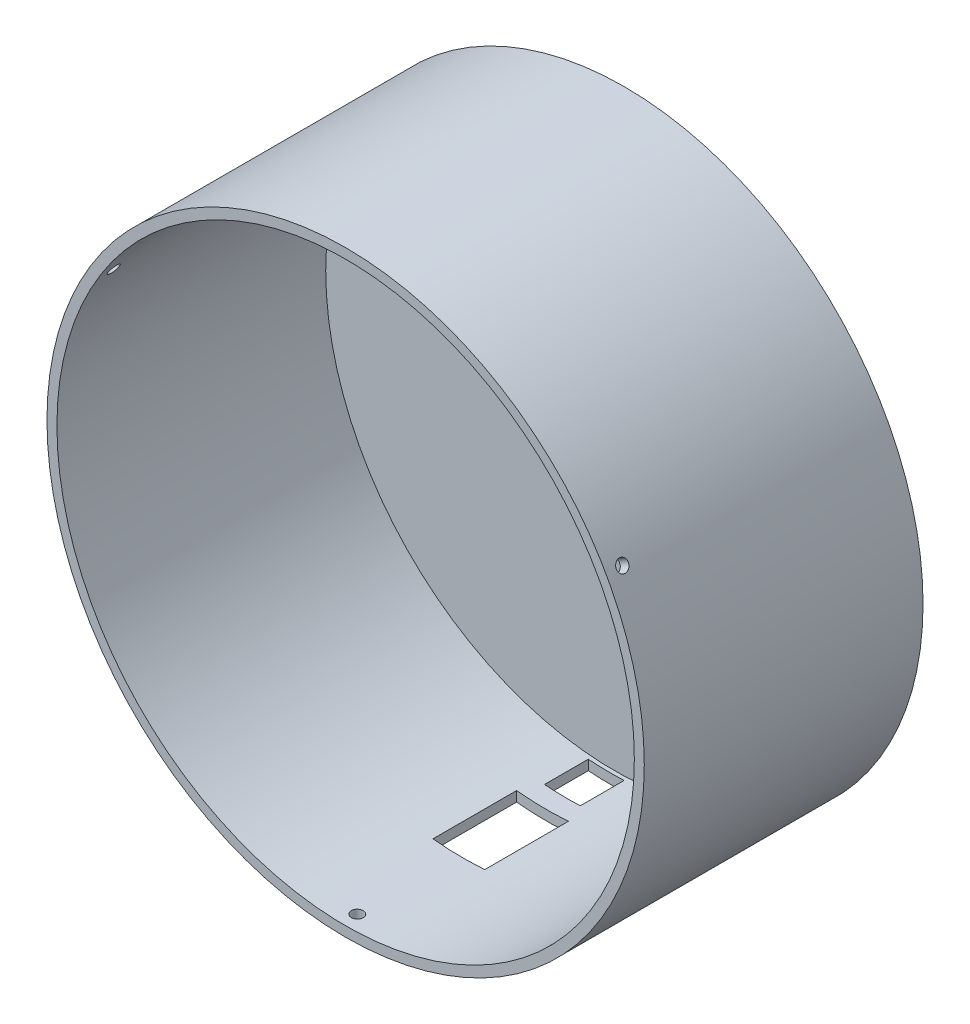
from build123d import *

# Parameters (mm, degrees)
SZKIC1_R                    = 75
DODANIE_WYCI_GNI_CIE1_DEPTH = 70
SKORUPA1_T                  = -2.5
SZKIC3_W                    = 13
SZKIC3_H                    = 21
WYTNIJ_WYCI_GNI_CIE1_DEPTH  = 60
SZKIC4_W                    = 9
SZKIC4_H                    = 11
WYTNIJ_WYCI_GNI_CIE2_DEPTH  = 60
SZKIC5_R                    = 1.5
WYTNIJ_WYCI_GNI_CIE3_DEPTH  = 60
SZYK_KO_OWY1_COUNT          = 3


with BuildPart() as part:
    # Szkic1 → Dodanie-wyciągnięcie1 (new body)
    with BuildSketch(Plane.XY):
        Circle(SZKIC1_R)
    extrude(amount=DODANIE_WYCI_GNI_CIE1_DEPTH)

    # Skorupa1
    skorupa1_openings = [part.faces().sort_by_distance(p)[0] for p in [
        (0, 0, 70),
    ]]
    offset(amount=SKORUPA1_T, openings=skorupa1_openings, kind=Kind.INTERSECTION)

    # Szkic3 → Wytnij-wyciągnięcie1 (cut)
    with BuildSketch(Plane(origin=(0, -75, 0), x_dir=(-1, 0, 0), z_dir=(0, -1, 0))):
        with Locations((1.061442615, -30)):
            Rectangle(SZKIC3_W, SZKIC3_H)
    extrude(amount=-WYTNIJ_WYCI_GNI_CIE1_DEPTH, mode=Mode.SUBTRACT)

    # Szkic4 → Wytnij-wyciągnięcie2 (cut)
    with BuildSketch(Plane(origin=(0, -75, 0), x_dir=(-1, 0, 0), z_dir=(0, -1, 0))):
        with Locations((1.061442615, -9)):
            Rectangle(SZKIC4_W, SZKIC4_H)
    extrude(amount=-WYTNIJ_WYCI_GNI_CIE2_DEPTH, mode=Mode.SUBTRACT)

    # Szkic5 → Wytnij-wyciągnięcie3 (cut)
    with BuildSketch(Plane(origin=(0, -75, 0), x_dir=(-1, 0, 0), z_dir=(0, -1, 0))):
        with Locations((1.061442615, -66)):
            Circle(SZKIC5_R)
    wytnij_wyci_gni_cie3 = extrude(amount=-WYTNIJ_WYCI_GNI_CIE3_DEPTH, mode=Mode.SUBTRACT)

    # Szyk kołowy1: Wytnij-wyciągnięcie3 ×3 about axis
    szyk_ko_owy1_axis = Axis((0, 0, 70), (0, 0, 1))
    for i in range(1, SZYK_KO_OWY1_COUNT):
        add(wytnij_wyci_gni_cie3.rotate(szyk_ko_owy1_axis, i * 360 / SZYK_KO_OWY1_COUNT), mode=Mode.SUBTRACT)


solid = part.part
